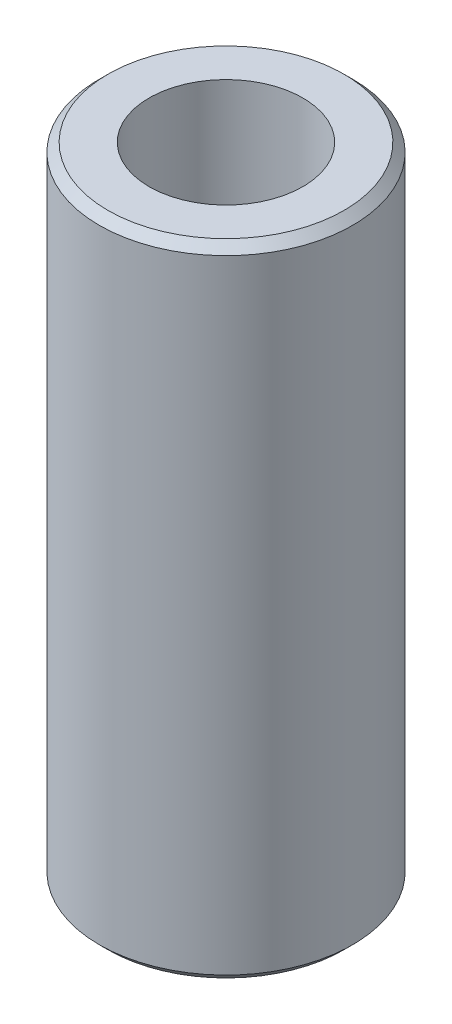
from build123d import *

# Parameters (mm, degrees)
SKETCH1_R           = 57.5
BOSS_EXTRUDE1_DEPTH = 290.682610445
SKETCH2_R           = 34.910680535
CUT_EXTRUDE1_DEPTH  = 302.842475498
CHAMFER1_SIZE       = 3.913029436


with BuildPart() as part:
    # Sketch1 → Boss-Extrude1 (new body)
    with BuildSketch(Plane(origin=(0, 0, 0), x_dir=(1, 0, 0), z_dir=(0, 1, 0))):
        Circle(SKETCH1_R)
    extrude(amount=BOSS_EXTRUDE1_DEPTH)

    # Sketch2 → Cut-Extrude1 (cut, through all)
    with BuildSketch(Plane(origin=(0, 0, 0), x_dir=(1, 0, 0), z_dir=(0, 1, 0))):
        Circle(SKETCH2_R)
    extrude(amount=CUT_EXTRUDE1_DEPTH, mode=Mode.SUBTRACT)

    # Chamfer1
    chamfer1_edges = [part.edges().sort_by_distance(p)[0] for p in [
        (-57.5, 290.682610445, 0),
        (-57.5, 0, 0),
    ]]
    chamfer(chamfer1_edges, length=CHAMFER1_SIZE)


solid = part.part
